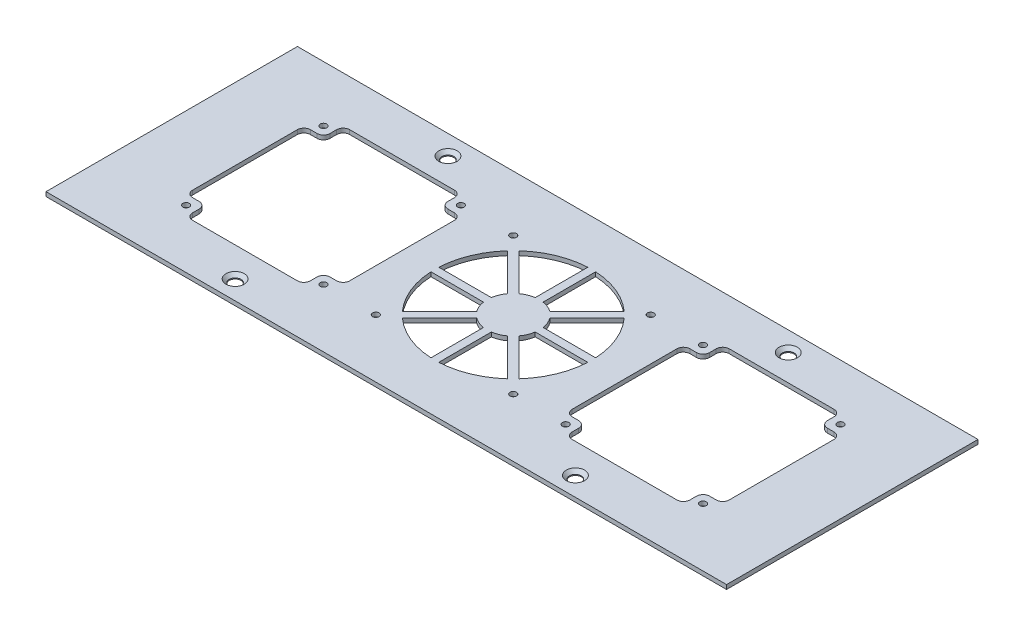
from build123d import *

# Parameters (mm, degrees)
SKETCH1_W          = 520
SKETCH1_H          = 192.12
BASE_FLANGE1_DEPTH = 3.26
SKETCH2_R          = 4.5
CUT_EXTRUDE1_DEPTH = 10
SKETCH3_R          = 2.5
CUT_EXTRUDE2_DEPTH = 10
SKETCH4_R          = 2.5
CUT_EXTRUDE3_DEPTH = 10
FILLET2_R          = 5
CHAMFER1_SIZE      = 2.5


# Sheet-metal steps are written as plain solids
with BuildPart() as part:
    # Sketch1 → Base-Flange1 (new body)
    with BuildSketch(Plane(origin=(0, 0, 0), x_dir=(1, 0, 0), z_dir=(0, 1, 0))):
        with Locations((0, -0.985)):
            Rectangle(SKETCH1_W, SKETCH1_H)
    extrude(amount=-BASE_FLANGE1_DEPTH)

    # Sketch2 → Cut-Extrude1 (cut)
    with BuildSketch(Plane(origin=(0, 0, 0), x_dir=(1, 0, 0), z_dir=(0, 1, 0))):
        with Locations(Location((130, 80.075, 0), (0, 0, 270))):
            Circle(SKETCH2_R)
        with Locations(Location((130, -82.545, 0), (0, 0, 270))):
            Circle(SKETCH2_R)
        with Locations(Location((-130, 80.075, 0), (0, 0, 270))):
            Circle(SKETCH2_R)
        with Locations(Location((-130, -82.545, 0), (0, 0, 270))):
            Circle(SKETCH2_R)
    extrude(amount=-CUT_EXTRUDE1_DEPTH, mode=Mode.SUBTRACT)

    # Sketch3 → Cut-Extrude2 (cut)
    with BuildSketch(Plane(origin=(0, 0, 0), x_dir=(1, 0, 0), z_dir=(0, 1, 0))):
        with Locations(Location((-52.5, 52.5, 0), (0, 0, 270))):
            Circle(SKETCH3_R)
        with Locations(Location((52.5, 52.5, 0), (0, 0, 270))):
            Circle(SKETCH3_R)
        with Locations(Location((52.5, -52.5, 0), (0, 0, 270))):
            Circle(SKETCH3_R)
        with Locations(Location((-52.5, -52.5, 0), (0, 0, 270))):
            Circle(SKETCH3_R)
        with BuildLine():
            Line((-3, -59.924953066), (-3, -19.773719933))
            ThreePointArc((-3, -19.773719933), (-7.653668647, -18.47759065), (-11.860811111, -16.103451798))
            Line((-11.860811111, -16.103451798), (-40.252020332, -44.494661019))
            ThreePointArc((-40.252020332, -44.494661019), (-22.961005942, -55.432771951), (-3, -59.924953066))
        make_face()
        with BuildLine():
            Line((-3, 59.924953066), (-3, 19.773719933))
            ThreePointArc((-3, 19.773719933), (-7.653668647, 18.47759065), (-11.860811111, 16.103451798))
            Line((-11.860811111, 16.103451798), (-40.252020332, 44.494661019))
            ThreePointArc((-40.252020332, 44.494661019), (-22.961005942, 55.432771951), (-3, 59.924953066))
        make_face()
        with BuildLine():
            Line((-19.773719933, 3), (-59.924953066, 3))
            ThreePointArc((-59.924953066, 3), (-55.432771951, 22.961005942), (-44.494661019, 40.252020332))
            Line((-44.494661019, 40.252020332), (-16.103451798, 11.860811111))
            ThreePointArc((-16.103451798, 11.860811111), (-18.47759065, 7.653668647), (-19.773719933, 3))
        make_face()
        with BuildLine():
            Line((-19.773719933, -3), (-59.924953066, -3))
            ThreePointArc((-59.924953066, -3), (-55.432771951, -22.961005942), (-44.494661019, -40.252020332))
            Line((-44.494661019, -40.252020332), (-16.103451798, -11.860811111))
            ThreePointArc((-16.103451798, -11.860811111), (-18.47759065, -7.653668647), (-19.773719933, -3))
        make_face()
        with BuildLine():
            Line((3, -59.924953066), (3, -19.773719933))
            ThreePointArc((3, -19.773719933), (7.653668647, -18.47759065), (11.860811111, -16.103451798))
            Line((11.860811111, -16.103451798), (40.252020332, -44.494661019))
            ThreePointArc((40.252020332, -44.494661019), (22.961005942, -55.432771951), (3, -59.924953066))
        make_face()
        with BuildLine():
            Line((44.494661019, -40.252020332), (16.103451798, -11.860811111))
            ThreePointArc((16.103451798, -11.860811111), (18.47759065, -7.653668647), (19.773719933, -3))
            Line((19.773719933, -3), (59.924953066, -3))
            ThreePointArc((59.924953066, -3), (55.432771951, -22.961005942), (44.494661019, -40.252020332))
        make_face()
        with BuildLine():
            Line((19.773719933, 3), (59.924953066, 3))
            ThreePointArc((59.924953066, 3), (55.432771951, 22.961005942), (44.494661019, 40.252020332))
            Line((44.494661019, 40.252020332), (16.103451798, 11.860811111))
            ThreePointArc((16.103451798, 11.860811111), (18.47759065, 7.653668647), (19.773719933, 3))
        make_face()
        with BuildLine():
            Line((40.252020332, 44.494661019), (11.860811111, 16.103451798))
            ThreePointArc((11.860811111, 16.103451798), (7.653668647, 18.47759065), (3, 19.773719933))
            Line((3, 19.773719933), (3, 59.924953066))
            ThreePointArc((3, 59.924953066), (22.961005942, 55.432771951), (40.252020332, 44.494661019))
        make_face()
    extrude(amount=-CUT_EXTRUDE2_DEPTH, mode=Mode.SUBTRACT)

    # Sketch4 → Cut-Extrude3 (cut)
    with BuildSketch(Plane(origin=(0, 0, 0), x_dir=(1, 0, 0), z_dir=(0, 1, 0))):
        with Locations(Location((-92.5, 52.5, 0), (0, 0, 270))):
            Circle(SKETCH4_R)
        with Locations(Location((-197.5, 52.5, 0), (0, 0, 270))):
            Circle(SKETCH4_R)
        with Locations(Location((-197.5, -52.5, 0), (0, 0, 270))):
            Circle(SKETCH4_R)
        with Locations(Location((-92.5, -52.5, 0), (0, 0, 270))):
            Circle(SKETCH4_R)
        with Locations(Location((92.5, -52.5, 0), (0, 0, 270))):
            Circle(SKETCH4_R)
        with Locations(Location((197.5, -52.5, 0), (0, 0, 270))):
            Circle(SKETCH4_R)
        with Locations(Location((197.5, 52.5, 0), (0, 0, 270))):
            Circle(SKETCH4_R)
        with Locations(Location((92.5, 52.5, 0), (0, 0, 270))):
            Circle(SKETCH4_R)
        Polygon((-100, 60), (-190, 60), (-190, 45), (-205, 45), (-205, -45), (-190, -45), (-190, -60), (-100, -60), (-100, -45), (-85, -45), (-85, 45), (-100, 45), align=None)
        Polygon((100, 45), (100, 60), (190, 60), (190, 45), (205, 45), (205, -45), (190, -45), (190, -60), (100, -60), (100, -45), (85, -45), (85, 45), align=None)
    extrude(amount=-CUT_EXTRUDE3_DEPTH, mode=Mode.SUBTRACT)

    # Fillet2
    fillet2_edges = [part.edges().sort_by_distance(p)[0] for p in [
        (-100, -1.63, -60),
        (-100, -1.63, -45),
        (-85, -1.63, -45),
        (-85, -1.63, 45),
        (-100, -1.63, 45),
        (-100, -1.63, 60),
        (-190, -1.63, 60),
        (-190, -1.63, 45),
        (-205, -1.63, 45),
        (-205, -1.63, -45),
        (-190, -1.63, -45),
        (-190, -1.63, -60),
        (85, -1.63, -45),
        (100, -1.63, -45),
        (100, -1.63, -60),
        (190, -1.63, -60),
        (190, -1.63, -45),
        (205, -1.63, -45),
        (205, -1.63, 45),
        (190, -1.63, 45),
        (190, -1.63, 60),
        (100, -1.63, 60),
        (100, -1.63, 45),
        (85, -1.63, 45),
    ]]
    fillet(fillet2_edges, radius=FILLET2_R)

    # Chamfer1
    chamfer1_edges = [part.edges().sort_by_distance(p)[0] for p in [
        (130, 0, -84.575),
        (130, 0, 78.045),
        (-130, 0, -84.575),
        (-130, 0, 78.045),
    ]]
    chamfer(chamfer1_edges, length=CHAMFER1_SIZE)


solid = part.part
